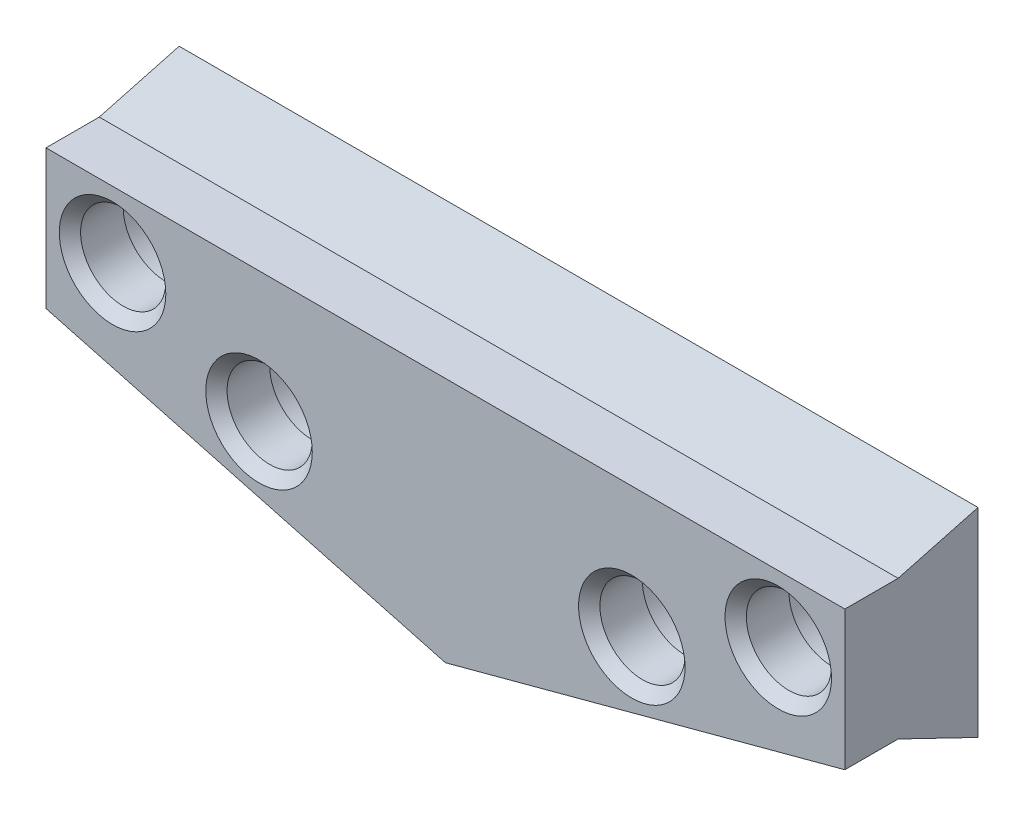
from build123d import *

# Parameters (mm, degrees)
RESSALTO_EXTRUS_O1_DEPTH   = 3
CHANFRO1_SIZE              = 5
CHANFRO1_SIZE_2            = 2.331538291
CHANFRO2_SIZE              = 1.339745962
CHANFRO2_SIZE_2            = 5
RESSALTO_EXTRUS_O2_DEPTH   = 2
CORTE_EXTRUS_O1_DEPTH      = 21.133400832
CORTE_EXTRUS_O1_DEPTH_BACK = 21.133400832
ESBO_O3_R                  = 1.6
ESBO_O4_R                  = 2
CORTE_EXTRUS_O2_DEPTH      = 3
ESBO_O6_W                  = 5.6
ESBO_O6_H                  = 6
CORTE_EXTRUS_O3_DEPTH      = 2
CHANFRO3_SIZE              = 0.4


with BuildPart() as part:
    # Esboço1 → Ressalto-extrusão1 (new body)
    with BuildSketch(Plane.XY):
        Polygon((-15, 13), (-15, 4.019237886), (0, 0), (15, 4.019237886), (15, 13), align=None)
    extrude(amount=RESSALTO_EXTRUS_O1_DEPTH)

    # Chanfro1
    # the kernel refuses this chamfer: 5, 2.331538291 mm, written as the material it takes off along each edge
    with BuildSketch(Plane(origin=(-27.513450616, 7.372206873, 3), x_dir=(-0.00422163992492442, -0.015755374691079384, -0.9998669641130704), z_dir=(0.9659258262890691, -0.25881904510251785, 0)), Plane(origin=(-12.513450616, -3.352968987, 3), x_dir=(0.004221639924924417, -0.015755374691079373, -0.9998669641130704), z_dir=(0.9659258262890691, 0.25881904510251785, 0))) as chanfro1_piece_1:
        Polygon((CHANFRO1_SIZE * 0.999866964113, CHANFRO1_SIZE * 0.0163111641311), (-CHANFRO1_SIZE_2 * 0.0163111641295, CHANFRO1_SIZE_2 * 0.999866964017), (0, 0), align=None)
    extrude(amount=41.43889742, mode=Mode.SUBTRACT)

    # Chanfro2
    # the kernel refuses this chamfer: 5, 1.339745962 mm, written as the material it takes off along each edge
    with BuildSketch(Plane(origin=(27.983607851, 13, 3), x_dir=(0, -0.9905000388259543, 0.13751244702128929), z_dir=(-1, 0, 0))) as chanfro2_piece_1:
        Polygon((CHANFRO2_SIZE * 0.990500038941, -CHANFRO2_SIZE * 0.137512447037), (-CHANFRO2_SIZE_2 * 0.137512447021, -CHANFRO2_SIZE_2 * 0.990500038826), (0, 0), align=None)
    extrude(amount=55.967215702, mode=Mode.SUBTRACT)

    # Esboço2 → Ressalto-extrusão2 (add)
    with BuildSketch(Plane.XY.offset(3)):
        Polygon((0, 2.413786056), (15, 6.433023943), (15, 11.660254038), (-15, 11.660254038), (-15, 6.433023943), align=None)
    extrude(amount=RESSALTO_EXTRUS_O2_DEPTH)

    # Esboço3 → Corte-extrusão1 (cut, two sides: drawn at the far end of the back side and taken through both)
    with BuildSketch(Plane.XY.offset(-CORTE_EXTRUS_O1_DEPTH_BACK)):
        with Locations((-7, 6.762338276)):
            Circle(ESBO_O3_R)
        with Locations(Location((7, 6.762338276, 0), (0, 0, 180))):
            Circle(ESBO_O3_R)
        with Locations((-12.5, 9.160254038)):
            Circle(ESBO_O3_R)
        with Locations(Location((12.5, 9.160254038, 0), (0, 0, 180))):
            Circle(ESBO_O3_R)
    extrude(amount=CORTE_EXTRUS_O1_DEPTH + CORTE_EXTRUS_O1_DEPTH_BACK, mode=Mode.SUBTRACT)

    # Esboço4 → Corte-extrusão2 (cut)
    with BuildSketch(Plane(origin=(0, 0, 0), x_dir=(-1, 0, 0), z_dir=(0, 0, -1))):
        with Locations(Location((-7, 6.762338276, 0), (0, 0, 180))):
            Circle(ESBO_O4_R)
        with Locations(Location((12.5, 9.160254038, 0), (0, 0, 180))):
            Circle(ESBO_O4_R)
        with Locations(Location((-12.5, 9.160254038, 0), (0, 0, 180))):
            Circle(ESBO_O4_R)
        with Locations(Location((7, 6.762338276, 0), (0, 0, 180))):
            Circle(ESBO_O4_R)
    extrude(amount=-CORTE_EXTRUS_O2_DEPTH, mode=Mode.SUBTRACT)

    # Esboço6 → Corte-extrusão3 (cut)
    with BuildSketch(Plane(origin=(0, 0, 0), x_dir=(-1, 0, 0), z_dir=(0, 0, -1))):
        with Locations((0, 7)):
            Rectangle(ESBO_O6_W, ESBO_O6_H)
    extrude(amount=-CORTE_EXTRUS_O3_DEPTH, mode=Mode.SUBTRACT)

    # Chanfro3
    chanfro3_edges = [part.edges().sort_by_distance(p)[0] for p in [
        (14.1, 9.160254038, 5),
        (-14.1, 9.160254038, 5),
        (8.6, 6.762338276, 5),
        (-8.6, 6.762338276, 5),
    ]]
    chamfer(chanfro3_edges, length=CHANFRO3_SIZE)


solid = part.part
